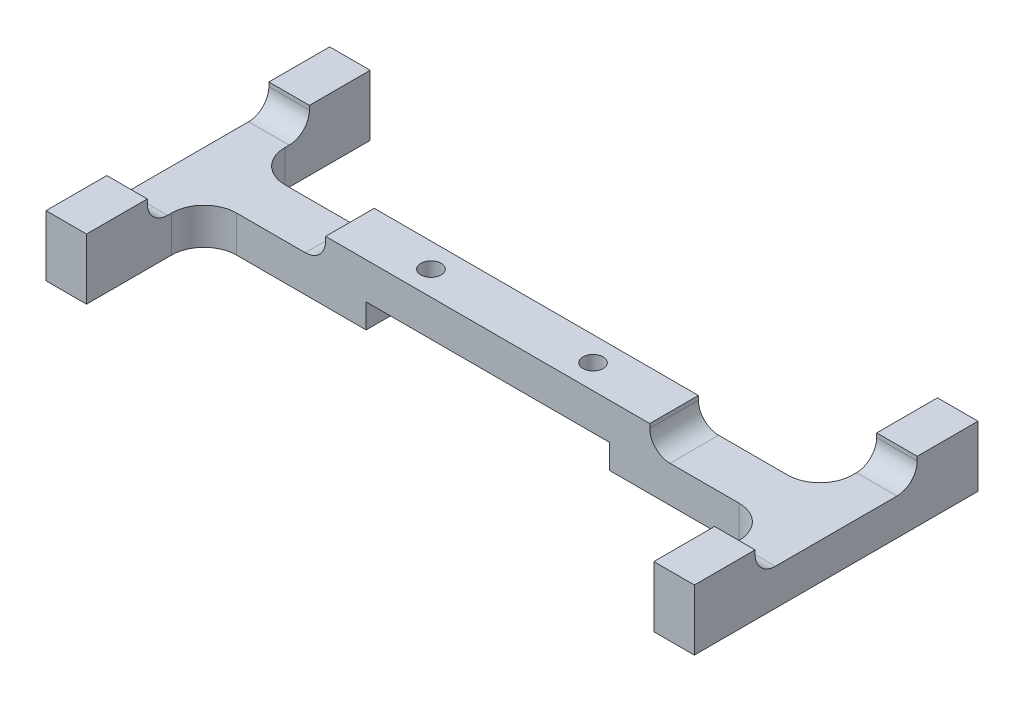
from build123d import *

# Parameters (mm, degrees)
SKETCH1_W           = 101.6
SKETCH1_H           = 44.45
BOSS_EXTRUDE1_DEPTH = 9.525
SKETCH2_W           = 88.9
SKETCH2_H           = 18.415
CUT_EXTRUDE1_DEPTH  = 57.261143341
FILLET1_R           = 5.08
SKETCH3_W           = 25.4
SKETCH3_H           = 25.4
CUT_EXTRUDE2_DEPTH  = 3.81
FILLET2_R           = 3.175
SKETCH4_R           = 1.5875
CUT_EXTRUDE3_DEPTH  = 57.261143341
SKETCH5_W           = 38.1
SKETCH5_H           = 7.62
CUT_EXTRUDE4_DEPTH  = 3.81


with BuildPart() as part:
    # Sketch1 → Boss-Extrude1 (new body)
    with BuildSketch(Plane(origin=(0, 0, 0), x_dir=(1, 0, 0), z_dir=(0, 1, 0))):
        Rectangle(SKETCH1_W, SKETCH1_H)
    extrude(amount=BOSS_EXTRUDE1_DEPTH)

    # Sketch2 → Cut-Extrude1 (cut, through all)
    with BuildSketch(Plane(origin=(0, 9.525, 0), x_dir=(1, 0, 0), z_dir=(0, 1, 0))):
        with Locations((0, -13.0175)):
            Rectangle(SKETCH2_W, SKETCH2_H)
    cut_extrude1 = extrude(amount=-CUT_EXTRUDE1_DEPTH, mode=Mode.SUBTRACT)

    # Mirror1: Cut-Extrude1 across plane
    add(cut_extrude1.mirror(Plane.XY), mode=Mode.SUBTRACT)

    # Fillet1
    fillet1_edges = [part.edges().sort_by_distance(p)[0] for p in [
        (44.45, 4.7625, -3.81),
        (44.45, 4.7625, 3.81),
        (-44.45, 4.7625, 3.81),
        (-44.45, 4.7625, -3.81),
    ]]
    fillet(fillet1_edges, radius=FILLET1_R)

    # Sketch3 → Cut-Extrude2 (cut)
    with BuildSketch(Plane(origin=(0, 9.525, 0), x_dir=(1, 0, 0), z_dir=(0, 1, 0))):
        with Locations((-38.1, 0)):
            Rectangle(SKETCH3_W, SKETCH3_H)
    cut_extrude2 = extrude(amount=-CUT_EXTRUDE2_DEPTH, mode=Mode.SUBTRACT)

    # Mirror2: Cut-Extrude2 across plane
    add(cut_extrude2.mirror(Plane(origin=(0, 0, 0), x_dir=(0, 0, 1), z_dir=(1, 0, 0))), mode=Mode.SUBTRACT)

    # Fillet2
    fillet2_edges = [part.edges().sort_by_distance(p)[0] for p in [
        (-25.4, 5.715, 0),
        (25.4, 5.715, 0),
        (47.625, 5.715, 12.7),
        (47.625, 5.715, -12.7),
        (-47.625, 5.715, 12.7),
        (-47.625, 5.715, -12.7),
    ]]
    fillet(fillet2_edges, radius=FILLET2_R)

    # Sketch4 → Cut-Extrude3 (cut, through all)
    with BuildSketch(Plane.XZ):
        with Locations((-12.7, 0)):
            Circle(SKETCH4_R)
    cut_extrude3 = extrude(amount=-CUT_EXTRUDE3_DEPTH, mode=Mode.SUBTRACT)

    # Sketch5 → Cut-Extrude4 (cut)
    with BuildSketch(Plane.XZ):
        Rectangle(SKETCH5_W, SKETCH5_H)
    extrude(amount=-CUT_EXTRUDE4_DEPTH, mode=Mode.SUBTRACT)

    # Mirror3: Cut-Extrude3 across plane
    add(cut_extrude3.mirror(Plane(origin=(0, 0, 0), x_dir=(0, 0, 1), z_dir=(1, 0, 0))), mode=Mode.SUBTRACT)


solid = part.part
